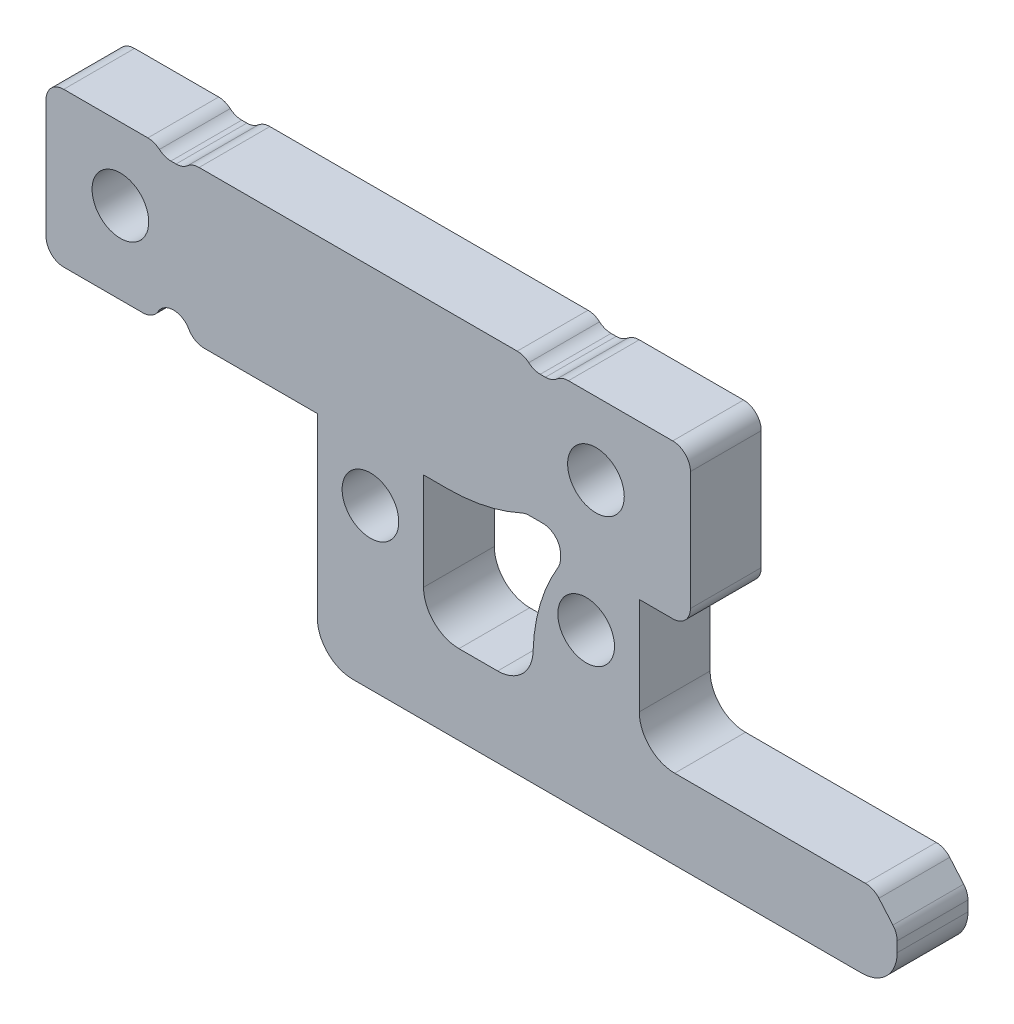
from build123d import *

# Parameters (mm, degrees)
SKETCH1_W            = 6.185857864
SKETCH1_H            = 7.5
BOSS_EXTRUDE1_DEPTH  = 4
FILLET1_R            = 2
M3_CLEARANCE_HOLE1_D = 3.2
SKETCH4_W            = 2
SKETCH4_H            = 0.481048
SKETCH4_H_2          = 1
CUT_EXTRUDE1_DEPTH   = 10
FILLET2_R            = 10
FILLET3_R            = 1
FILLET4_R            = 1


with BuildPart() as part:
    # Sketch1 → Boss-Extrude1 (new body)
    with BuildSketch(Plane.XY):
        Polygon((-4.235857864, -11.50026715), (-4.235857864, 0.5), (-19.56054874, 0.5), (-19.56054874, 9.2), (16.83945126, 9.2), (16.83945126, 0.5), (13.95, 0.5), (13.95, -7), (27.186678327, -7), (28.517391444, -8.547881241), (28.517391444, -11.5), align=None)
        with Locations((4.857071068, -3.25)):
            Rectangle(SKETCH1_W, SKETCH1_H, mode=Mode.SUBTRACT)
    extrude(amount=BOSS_EXTRUDE1_DEPTH)

    # Fillet1
    fillet1_edges = [part.edges().sort_by_distance(p)[0] for p in [
        (1.764142136, -7, 2),
        (7.95, -7, 2),
        (-4.235857864, -11.50026715, 2),
        (13.95, -7, 2),
        (28.517391444, -11.5, 2),
    ]]
    fillet(fillet1_edges, radius=FILLET1_R)

    # M3 Clearance Hole1 (through all)
    with Locations(Plane.XY.offset(4)):
        with Locations((10.95, -2.5), (-1.235857864, -2.5), (11.502527164, 5.109476), (-15.36054874, 5.109476)):
            Hole(M3_CLEARANCE_HOLE1_D / 2)

    # Sketch4 → Cut-Extrude1 (cut)
    with BuildSketch(Plane.XY.offset(4)):
        with Locations((8.502527164, 8.959476)):
            Rectangle(SKETCH4_W, SKETCH4_H)
        with Locations((-12.36054874, 8.959476)):
            Rectangle(SKETCH4_W, SKETCH4_H)
        with Locations((-12.36054874, 1)):
            Rectangle(SKETCH4_W, SKETCH4_H_2)
        Polygon((7.502527164, 0.5), (7.502527164, 1.5), (9.502527164, 1.5), (9.502527164, 0.5), (9.502527164, 0), (7.502527164, 0), align=None)
    extrude(amount=-CUT_EXTRUDE1_DEPTH, mode=Mode.SUBTRACT)

    # Fillet2
    # the kernel refuses this fillet: 10 mm, written as the material it takes off along each edge
    with BuildSketch(Plane(origin=(7.502527164, 0.5, -10.897247359), x_dir=(-1, 0, 0), z_dir=(0, 0, 1))) as fillet2_piece_1:
        with BuildLine():
            CenterArc((4.358898944, -10), FILLET2_R, 90, 25.841932763)
            Line((0, -1), (0, 0))
            Line((0, 0), (4.358898944, 0))
        make_face()
    extrude(amount=25.794494718, mode=Mode.SUBTRACT)
    with BuildSketch(Plane(origin=(7.95, 0, 16.650074726), x_dir=(1.0, -2.8096218791575343e-12, 0), z_dir=(0, 0, -1))) as fillet2_piece_2:
        with BuildLine():
            CenterArc((9.994593415, 5.36017886), FILLET2_R, 181.719985699, 30.692982598)
            Line((-0.000901098, 5.06002981), (-1.000450549, 5.030014905))
            ThreePointArc((-1.000450549, 5.030014905), (-1, 5), (-1, 0))
            Line((-1, 0), (0, -1))
            ThreePointArc((0, -1), (0.776263582, -1), (0.708320539, -0.536017886))
            Line((0.708320539, -0.536017886), (1.552527164, 0))
        make_face()
    extrude(amount=29.300149451, mode=Mode.SUBTRACT)

    # Fillet3
    # the kernel refuses this fillet: 1 mm, written as the material it adds along each edge
    with BuildSketch(Plane(origin=(9.502527164, 0, 4), x_dir=(0, 1, 0), z_dir=(0, 0, -1))) as fillet3_piece_1:
        with BuildLine():
            CenterArc((0.283169872, -1), FILLET3_R, 90, 30.865981789)
            ThreePointArc((-0.229861831, -0.141630341), (-0.114452906, -0.071590966), (0, 0))
            Line((0, 0), (0.283169872, 0))
        make_face()
    extrude(amount=4)
    with BuildSketch(Plane(origin=(9.502527164, 1.5, 4), x_dir=(-1, 0, 0), z_dir=(0, 0, -1))) as fillet3_piece_2:
        with BuildLine():
            CenterArc((FILLET3_R, -FILLET3_R), FILLET3_R, 90, 90)
            Line((0, -FILLET3_R), (0, 0))
            Line((0, 0), (FILLET3_R, 0))
        make_face()
    extrude(amount=4)
    with BuildSketch(Plane(origin=(7.502527164, 1.5, 4), x_dir=(-0.9045968857212806, -0.42626807802527333, 0), z_dir=(0, 0, -1))) as fillet3_piece_3:
        with BuildLine():
            CenterArc((0.223930785, -0.999943145), FILLET3_R, 90.610977717, 24.619977329)
            Line((-0.202337293, -0.095346259), (0, 0))
            ThreePointArc((0, 0), (0.106633707, -0.000568554), (0.213267415, 0))
        make_face()
    extrude(amount=4)
    with BuildSketch(Plane(origin=(-13.36054874, 8.718952, 4), x_dir=(0, 1, 0), z_dir=(0, 0, -1))) as fillet3_piece_4:
        with BuildLine():
            CenterArc((1, 0.854803382), FILLET3_R, 180, 58.738020049)
            Line((0, 0.854803382), (0, 0))
            Line((0, 0), (0.481048, 0))
        make_face()
    extrude(amount=4)
    with BuildSketch(Plane(origin=(-11.36054874, 8.718952, 4), x_dir=(-1, 0, 0), z_dir=(0, 0, -1))) as fillet3_piece_5:
        with BuildLine():
            CenterArc((0.854803382, 1), FILLET3_R, 211.261979951, 58.738020049)
            Line((0, 0.481048), (0, 0))
            Line((0, 0), (0.854803382, 0))
        make_face()
    extrude(amount=4)
    with BuildSketch(Plane(origin=(9.502527164, 8.718952, 4), x_dir=(0, 1, 0), z_dir=(0, 0, -1))) as fillet3_piece_6:
        with BuildLine():
            CenterArc((1, -0.854803382), FILLET3_R, 121.261979951, 58.738020049)
            Line((0, -0.854803382), (0, 0))
            Line((0, 0), (0.481048, 0))
        make_face()
    extrude(amount=4)
    with BuildSketch(Plane(origin=(7.502527164, 8.718952, 4), x_dir=(1, 0, 0), z_dir=(0, 0, -1))) as fillet3_piece_7:
        with BuildLine():
            CenterArc((0.854803382, -1), FILLET3_R, 90, 58.738020049)
            Line((0, -0.481048), (0, 0))
            Line((0, 0), (0.854803382, 0))
        make_face()
    extrude(amount=4)
    with BuildSketch(Plane(origin=(-13.36054874, 1.5, 4), x_dir=(1, 0, 0), z_dir=(0, 0, -1)), Plane(origin=(-11.36054874, 1.5, 4), x_dir=(0, -1, 0), z_dir=(0, 0, -1))) as fillet3_piece_8:
        with BuildLine():
            CenterArc((FILLET3_R, FILLET3_R), FILLET3_R, 180, 90)
            Line((0, FILLET3_R), (0, 0))
            Line((0, 0), (FILLET3_R, 0))
        make_face()
    extrude(amount=4)
    # the kernel refuses this fillet: 1 mm, written as the material it takes off along each edge
    with BuildSketch(Plane(origin=(28.517391444, -8.547881241, -0.926902713), x_dir=(0, -1, 0), z_dir=(0, 0, 1))) as fillet3_2_piece_1:
        with BuildLine():
            CenterArc((FILLET3_R * 0.370761085346, -FILLET3_R), FILLET3_R, 90, 40.685640486)
            Line((-FILLET3_R * 0.28114729377, -FILLET3_R * 0.241702258187), (0, 0))
            Line((0, 0), (FILLET3_R * 0.370761085346, 0))
        make_face()
    extrude(amount=5.853805427, mode=Mode.SUBTRACT)
    with BuildSketch(Plane(origin=(27.186678327, -7, -1.147608656), x_dir=(0.6519083791154829, -0.7582977418132165, 0), z_dir=(0, 0, 1))) as fillet3_2_piece_2:
        with BuildLine():
            CenterArc((FILLET3_R * 0.459043462337, -FILLET3_R), FILLET3_R, 90, 49.314359514)
            Line((-FILLET3_R * 0.299254279476, -FILLET3_R * 0.348091620885), (0, 0))
            Line((0, 0), (FILLET3_R * 0.459043462337, 0))
        make_face()
    extrude(amount=6.295217312, mode=Mode.SUBTRACT)
    with BuildSketch(Plane(origin=(-19.56054874, 0.5, -2.5), x_dir=(0, 1, 0), z_dir=(0, 0, 1)), Plane(origin=(-19.56054874, 9.2, -2.5), x_dir=(1, 0, 0), z_dir=(0, 0, 1)), Plane(origin=(16.83945126, 9.2, -2.5), x_dir=(0, -1, 0), z_dir=(0, 0, 1)), Plane(origin=(16.83945126, 0.5, -2.5), x_dir=(-1, 0, 0), z_dir=(0, 0, 1))) as fillet3_2_piece_3:
        with BuildLine():
            CenterArc((FILLET3_R, -FILLET3_R), FILLET3_R, 90, 90)
            Line((0, -FILLET3_R), (0, 0))
            Line((0, 0), (FILLET3_R, 0))
        make_face()
    extrude(amount=9, mode=Mode.SUBTRACT)

    # Fillet4
    fillet4_edges = [part.edges().sort_by_distance(p)[0] for p in [
        (9.502527164, 9.2, 2),
        (7.502527164, 9.2, 2),
        (-11.36054874, 9.2, 2),
        (-13.36054874, 9.2, 2),
        (-13.36054874, 0.5, 2),
        (-11.36054874, 0.5, 2),
    ]]
    fillet(fillet4_edges, radius=FILLET4_R)


solid = part.part
